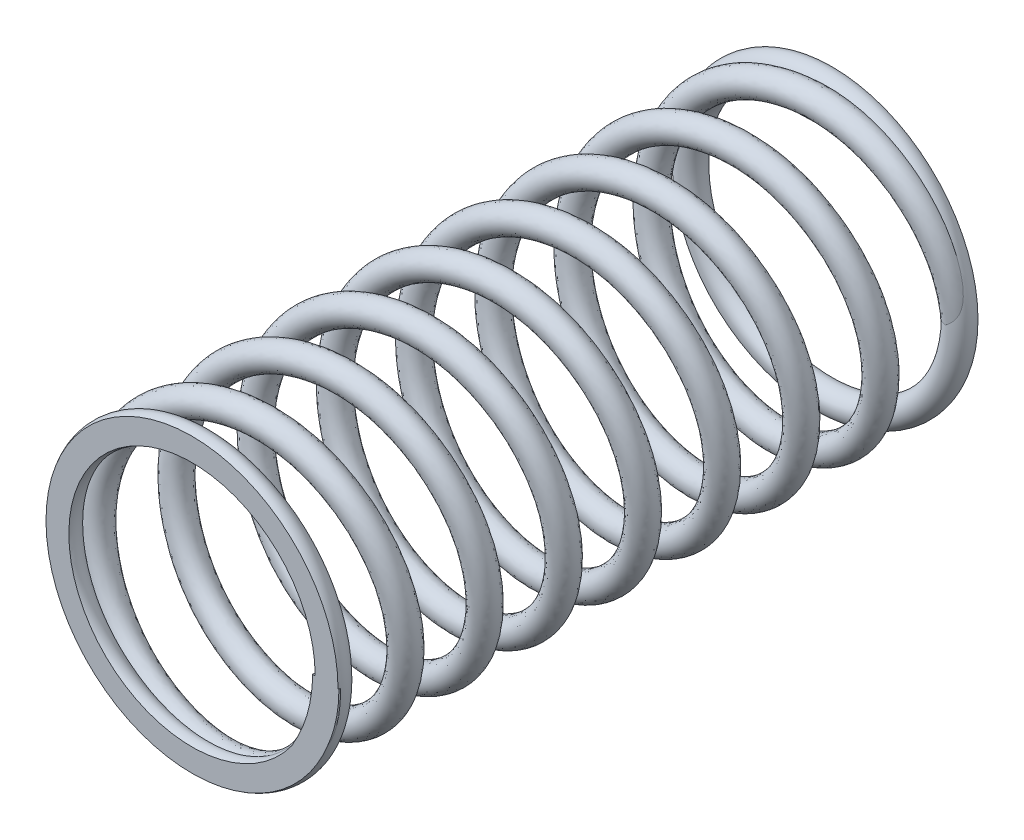
from build123d import *

# Parameters (mm, degrees)
SKETCH5_R            = 0.0635
SWEEP1_PITCH         = 0.381
SWEEP1_HEIGHT        = 3.048
SWEEP1_RADIUS        = 0.6477
SWEEP1_START_ANGLE   = 180
SKETCH6_R            = 0.0635
SKETCH7_R            = 0.0635
EXTRUDE1_START       = -0.702692713
EXTRUDE1_OUTLINE_W   = 1.92025
EXTRUDE1_OUTLINE_H   = 4
EXTRUDE1_OUTLINE_W_2 = 2
EXTRUDE1_DEPTH       = 1.409661148


# Read off the part's stored shape, not the designer's step: Extrude1
with BuildPart() as part:
    # Sketch5 → Revolve2 (revolve)
    with BuildSketch(Plane(origin=(0, 0, 0), x_dir=(0, 0, -1), z_dir=(1, 0, 0)), mode=Mode.PRIVATE) as revolve2_sk:
        with Locations((0.03175, 0.6477)):
            Circle(SKETCH5_R)
    revolve(revolve2_sk.sketch.rotate(Axis((0, 0, -19.285577921), (0, 0, 1)), 90), axis=Axis((0, 0, -19.285577921), (0, 0, 1)))

    # Sweep1: sweep along a helix
    with BuildLine() as sweep1_path:
        add(Helix(SWEEP1_PITCH, SWEEP1_HEIGHT, SWEEP1_RADIUS, center=(0, 0, 0), direction=(0, 0, -1), mode=Mode.PRIVATE).rotate(Axis((0, 0, 0), (0, 0, -1)), SWEEP1_START_ANGLE))
    # Sketch6 → Sweep1 (sweep)
    with BuildSketch(Plane(origin=(0.6477, 0, 0), x_dir=(1, 0, 0), z_dir=(0, -0.9956461952480538, -0.09321294914374458))):
        with Locations((-0.004231665, 0)):
            Circle(SKETCH6_R)
    sweep(path=sweep1_path.line, is_frenet=True)

    # Sketch7 → Revolve3 (revolve)
    with BuildSketch(Plane(origin=(0, 0, 0), x_dir=(0, 0, -1), z_dir=(1, 0, 0)), mode=Mode.PRIVATE) as revolve3_sk:
        with Locations((3.048, 0.6477)):
            Circle(SKETCH7_R)
    revolve(revolve3_sk.sketch.rotate(Axis((0, 0, -19.285577921), (0, 0, 1)), 180.109654114), axis=Axis((0, 0, -19.285577921), (0, 0, 1)))

    # Extrude1 outline → Extrude1 (cut)
    with BuildSketch(Plane(origin=(0, 0, 0), x_dir=(0, 0, -1), z_dir=(1, 0, 0)).offset(EXTRUDE1_START)):
        with Locations((4.039875, 0)):
            Rectangle(EXTRUDE1_OUTLINE_W, EXTRUDE1_OUTLINE_H)
        with Locations((-1, 0)):
            Rectangle(EXTRUDE1_OUTLINE_W_2, EXTRUDE1_OUTLINE_H)
    extrude(amount=EXTRUDE1_DEPTH, mode=Mode.SUBTRACT)


solid = part.part
